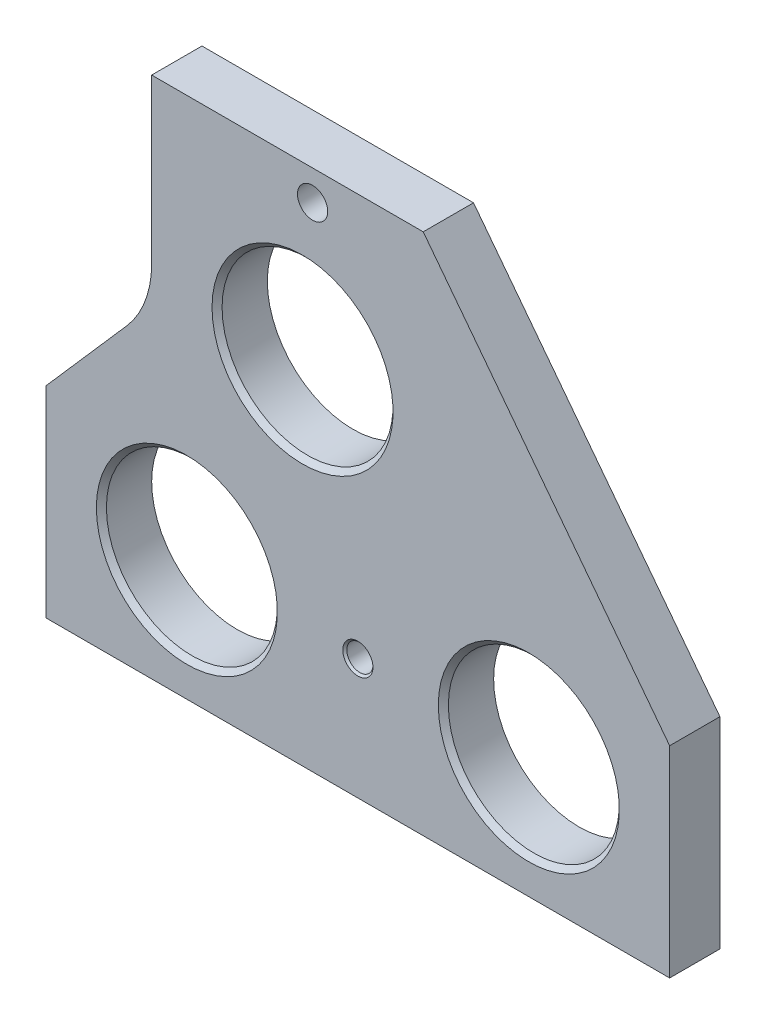
from build123d import *

# Parameters (mm, degrees)
SZKIC1_R                    = 8.5
SZKIC1_R_2                  = 1.5
SZKIC1_R_3                  = 1.3
DODANIE_WYCI_GNI_CIE1_DEPTH = 5
SFAZOWANIE2_SIZE            = 0.5
SFAZOWANIE3_SIZE            = 0.2
ZAOKR_GLENIE1_R             = 10


with BuildPart() as part:
    # Szkic1 → Dodanie-wyciągnięcie1 (new body)
    with BuildSketch(Plane.XY):
        Polygon((-14, -12), (-14, 8), (-3.5, 20), (-3.5, 40), (23.5, 40), (48, 8), (48, -12), align=None)
        Circle(SZKIC1_R, mode=Mode.SUBTRACT)
        with Locations((34, 0)):
            Circle(SZKIC1_R, mode=Mode.SUBTRACT)
        with Locations((11.5, 23)):
            Circle(SZKIC1_R, mode=Mode.SUBTRACT)
        with Locations((12.5, 37)):
            Circle(SZKIC1_R_2, mode=Mode.SUBTRACT)
        with Locations((17, 0)):
            Circle(SZKIC1_R_3, mode=Mode.SUBTRACT)
    extrude(amount=DODANIE_WYCI_GNI_CIE1_DEPTH)

    # Sfazowanie2
    sfazowanie2_edges = [part.edges().sort_by_distance(p)[0] for p in [
        (25.5, 0, 5),
        (3, 23, 5),
        (-8.5, 0, 5),
    ]]
    chamfer(sfazowanie2_edges, length=SFAZOWANIE2_SIZE)

    # Sfazowanie3
    sfazowanie3_edges = [part.edges().sort_by_distance(p)[0] for p in [
        (15.7, 0, 0),
        (15.7, 0, 5),
    ]]
    chamfer(sfazowanie3_edges, length=SFAZOWANIE3_SIZE)

    # Zaokrąglenie1
    zaokr_glenie1_edges = [part.edges().sort_by_distance(p)[0] for p in [
        (-3.5, 20, 2.5),
    ]]
    fillet(zaokr_glenie1_edges, radius=ZAOKR_GLENIE1_R)


solid = part.part
